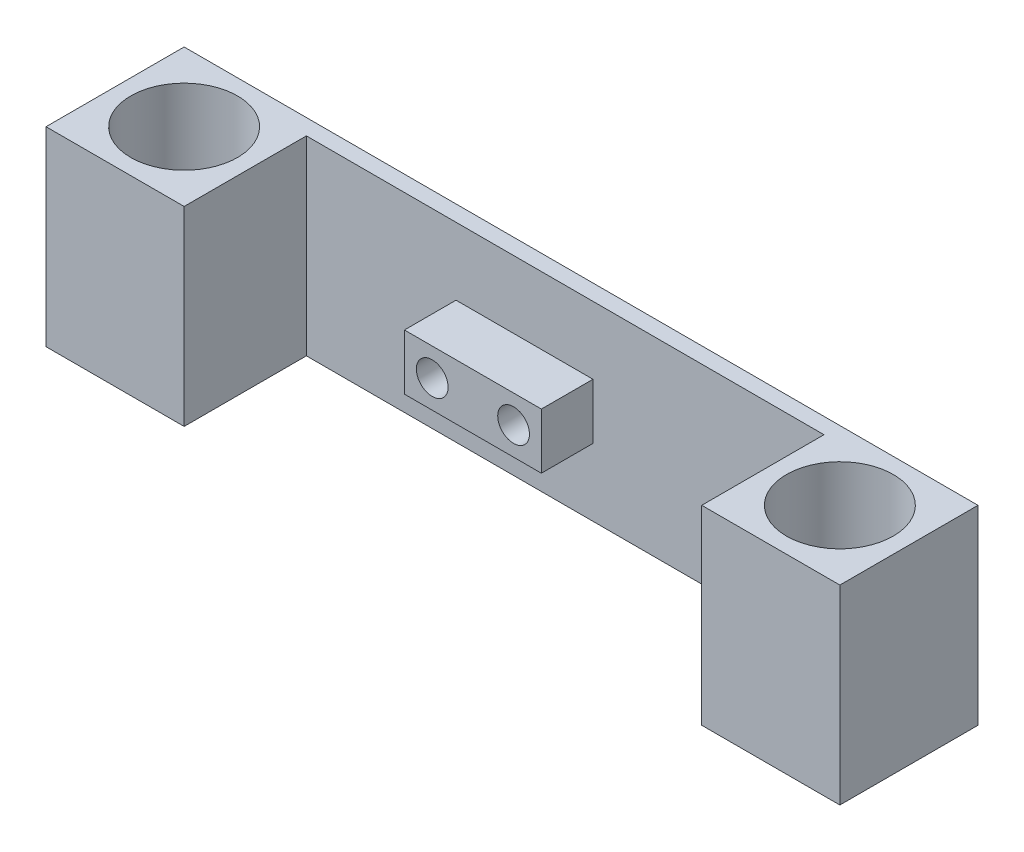
from build123d import *

# Parameters (mm, degrees)
SKETCH1_R           = 13.45
BOSS_EXTRUDE2_DEPTH = 48
SKETCH7_W           = 34.5
SKETCH7_H           = 14
SKETCH7_R           = 4
BOSS_EXTRUDE3_DEPTH = 13


with BuildPart() as part:
    # Sketch1 → Boss-Extrude2 (new body)
    with BuildSketch(Plane(origin=(0, 0, 0), x_dir=(1, 0, 0), z_dir=(0, 1, 0))):
        Polygon((-17.4, 17.4), (17.4, 17.4), (17.4, -17.4), (-17.4, -17.4), (-17.4, 13.4), (-82.6, 13.4), (-82.6, 17.4), align=None)
        Circle(SKETCH1_R, mode=Mode.SUBTRACT)
    boss_extrude2 = extrude(amount=BOSS_EXTRUDE2_DEPTH)

    # Mirror2: Boss-Extrude2 across plane
    add(boss_extrude2.mirror(Plane(origin=(-82.6, 48, -17.4), x_dir=(0, 0, 1), z_dir=(1, 0, 0))))

    # Sketch7 → Boss-Extrude3 (add)
    with BuildSketch(Plane.XY.offset(-13.4)):
        with Locations((-92.85, 24)):
            Rectangle(SKETCH7_W, SKETCH7_H)
        with Locations((-82.6, 24)):
            Circle(SKETCH7_R, mode=Mode.SUBTRACT)
        with Locations((-103.1, 24)):
            Circle(SKETCH7_R, mode=Mode.SUBTRACT)
    extrude(amount=BOSS_EXTRUDE3_DEPTH)


solid = part.part
